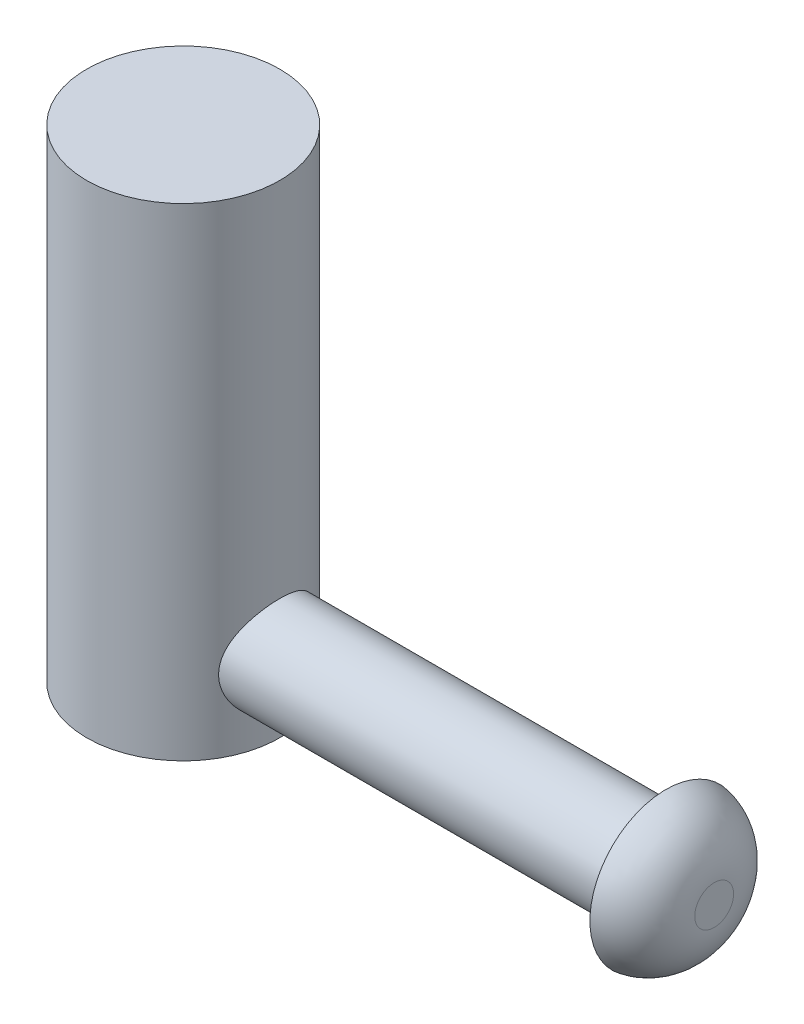
from build123d import *

# Parameters (mm, degrees)
SKETCH1_R                = 25.4
BOSS_EXTRUDE1_DEPTH      = 127
BOSS_EXTRUDE2_REACH      = 202
BOSS_EXTRUDE2_END_RADIUS = 25.4
SKETCH3_R                = 12.7
SKETCH4_R                = 20
BOSS_EXTRUDE3_DEPTH      = 12.7
FILLET1_R                = 15.08


with BuildPart() as part:
    # Sketch1 → Boss-Extrude1 (new body)
    with BuildSketch(Plane(origin=(0, 0, 0), x_dir=(1, 0, 0), z_dir=(0, 1, 0))):
        with Locations(Location((0, 0, 0), (0, 0, 270))):
            Circle(SKETCH1_R)
    extrude(amount=BOSS_EXTRUDE1_DEPTH)

    # Boss-Extrude2: up to this cylinder (the profile starts outside it)
    boss_extrude2_end = Plane(origin=(0, 19.05, 0), z_dir=(0, -1, 0)) * Cylinder(BOSS_EXTRUDE2_END_RADIUS, 455.8, mode=Mode.PRIVATE)
    # Sketch3 → Boss-Extrude2 (add, up to the surface)
    with BuildSketch(Plane(origin=(127, 0, 0), x_dir=(0, 0, -1), z_dir=(1, 0, 0)), mode=Mode.PRIVATE) as boss_extrude2_sk1:
        with Locations((0, 19.05)):
            Circle(SKETCH3_R)
    boss_extrude2_tool1 = extrude(boss_extrude2_sk1.sketch, amount=-BOSS_EXTRUDE2_REACH, mode=Mode.PRIVATE) - boss_extrude2_end
    add(boss_extrude2_tool1.solids().sort_by_distance((127, 19.05, 0))[0])

    # Sketch4 → Boss-Extrude3 (add)
    with BuildSketch(Plane(origin=(127, 0, 0), x_dir=(0, 0, -1), z_dir=(1, 0, 0))):
        with Locations((0, 19.05)):
            Circle(SKETCH4_R)
    extrude(amount=BOSS_EXTRUDE3_DEPTH)

    # Fillet1
    # the kernel refuses this fillet: 15.08 mm, written as the material it takes off along each edge
    with BuildSketch(Plane(origin=(139.7, 19.05, 0), x_dir=(0, 0, -1), z_dir=(0, -1, 0))) as fillet1_piece_1:
        with BuildLine():
            CenterArc((5.108996004, -15.08), FILLET1_R, 9.080670078, 80.919329922)
            Line((5.108996004, 0), (5.108996004, 0.3016))
            Line((5.108996004, 0.3016), (20, 0.3016))
            Line((20, 0.3016), (20.3016, 0))
            ThreePointArc((20.3016, 0), (20.3016, -6.35), (20.29782008, -12.6524))
            Line((20.29782008, -12.6524), (20, -12.7))
        make_face()
    revolve(axis=Axis((139.7, 19.05, 0), (1, 0, 0)), mode=Mode.SUBTRACT)


solid = part.part
